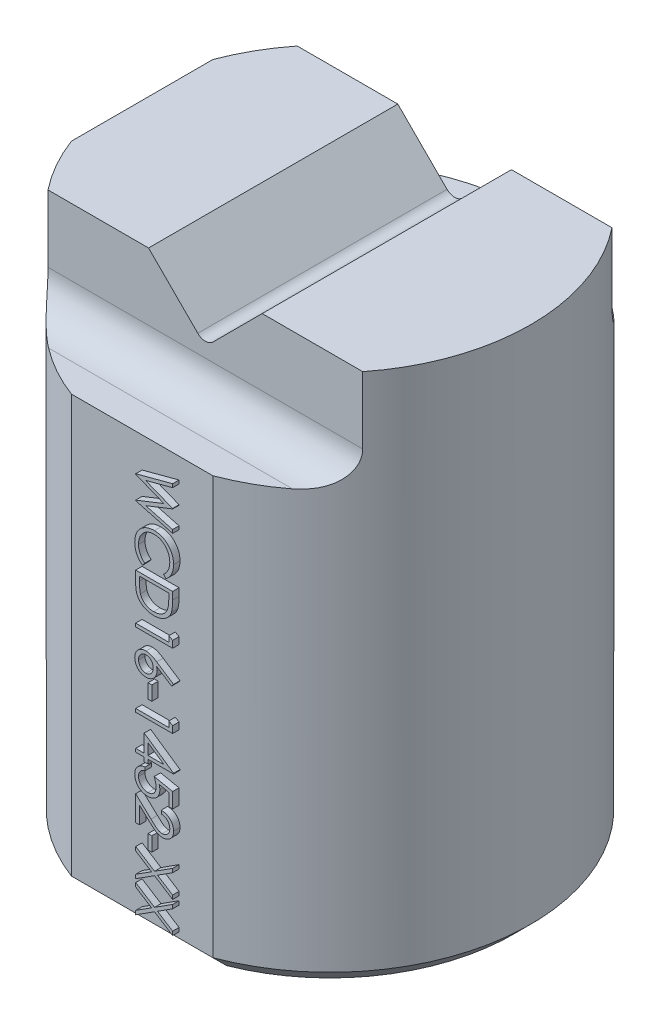
from build123d import *

# Parameters (mm, degrees)
CROQUIS3_R                 = 19.0246
SALIENTE_EXTRUIR1_DEPTH    = 50.8
CORTAR_EXTRUIR2_DEPTH      = 58.42
CORTAR_EXTRUIR2_DEPTH_BACK = 58.42
CORTAR_EXTRUIR4_DEPTH      = 58.42
CORTAR_EXTRUIR4_DEPTH_BACK = 58.42
CROQUIS9_R                 = 3.81
CORTAR_EXTRUIR1_START      = -58.42
CORTAR_EXTRUIR1_DEPTH      = 58.42
CROQUIS12_W                = 0.358974359
CROQUIS12_H                = 1.346153846
SALIENTE_EXTRUIR2_DEPTH    = 18.415
CHAFL_N1_SIZE              = 1.5875


with BuildPart() as part:
    # Croquis3 → Saliente-Extruir1 (new body)
    with BuildSketch(Plane(origin=(0, 0, 0), x_dir=(1, 0, 0), z_dir=(0, 1, 0))):
        with Locations(Location((0, 0, 0), (0, 0, 270))):
            Circle(CROQUIS3_R)
    extrude(amount=SALIENTE_EXTRUIR1_DEPTH)

    # Croquis7 → Cortar-Extruir2 (cut, two sides: drawn at the far end of the back side and taken through both)
    with BuildSketch(Plane(origin=(0, 0, 0), x_dir=(0, 0, -1), z_dir=(1, 0, 0)).offset(-CORTAR_EXTRUIR2_DEPTH_BACK)):
        with BuildLine():
            Line((19.0246, 50.8), (19.0246, 41.148))
            Line((19.0246, 41.148), (15.113, 41.148))
            ThreePointArc((15.113, 41.148), (12.778133409, 42.115133409), (11.811, 44.45))
            Line((11.811, 44.45), (11.811, 50.8))
            Line((11.811, 50.8), (19.0246, 50.8))
        make_face()
        with BuildLine():
            Line((-11.811, 50.8), (-19.0246, 50.8))
            Line((-19.0246, 50.8), (-19.0246, 41.148))
            Line((-19.0246, 41.148), (-15.113, 41.148))
            ThreePointArc((-15.113, 41.148), (-12.778133409, 42.115133409), (-11.811, 44.45))
            Line((-11.811, 44.45), (-11.811, 50.8))
        make_face()
    extrude(amount=CORTAR_EXTRUIR2_DEPTH + CORTAR_EXTRUIR2_DEPTH_BACK, mode=Mode.SUBTRACT)

    # Croquis9 → Cortar-Extruir4 (cut, two sides: drawn at the far end of the back side and taken through both)
    with BuildSketch(Plane.XY.offset(-CORTAR_EXTRUIR4_DEPTH_BACK)):
        with Locations((0, 50.803353673)):
            Circle(CROQUIS9_R)
        with BuildLine():
            Line((-5.3848, 50.8), (-0.71842049, 46.13362049))
            ThreePointArc((-0.71842049, 46.13362049), (0, 45.836040979), (0.71842049, 46.13362049))
            Line((0.71842049, 46.13362049), (5.3848, 50.8))
            Line((5.3848, 50.8), (-5.3848, 50.8))
        make_face()
    extrude(amount=CORTAR_EXTRUIR4_DEPTH + CORTAR_EXTRUIR4_DEPTH_BACK, mode=Mode.SUBTRACT)

    # Croquis4 → Cortar-Extruir1 (cut)
    with BuildSketch(Plane(origin=(0, 50.8, 0), x_dir=(1, 0, 0), z_dir=(0, 1, 0)).offset(CORTAR_EXTRUIR1_START)):
        with BuildLine():
            Line((0, -17.8054), (-6.700980227, -17.8054))
            ThreePointArc((-6.700980227, -17.8054), (0, -19.0246), (6.700980227, -17.8054))
            Line((6.700980227, -17.8054), (0, -17.8054))
        make_face()
        with BuildLine():
            Line((-17.8054, 0), (-17.8054, -6.700980227))
            ThreePointArc((-17.8054, -6.700980227), (-19.0246, 0), (-17.8054, 6.700980227))
            Line((-17.8054, 6.700980227), (-17.8054, 0))
        make_face()
    extrude(amount=CORTAR_EXTRUIR1_DEPTH, mode=Mode.SUBTRACT)

    # Croquis12 → Saliente-Extruir2 (add)
    # profile 1 of 13: a face of its own
    with BuildSketch(Plane.XY):
        Polygon((3.5, 4.666948718), (3.5, 4.30446875), (2.069010417, 3.388803686), (3.5, 2.473839744), (3.5, 2.10925641), (1.78505609, 3.206512019), (0, 2.064384615), (0, 2.426864583), (1.501802885, 3.388102564), (0, 4.348639423), (0, 4.711820513), (1.785757212, 3.569693109), align=None)
    # profile 2 of 13: a face of its own
    with BuildSketch(Plane.XY):
        Polygon((3.5, 7.628487179), (3.5, 7.266007212), (2.069010417, 6.350342147), (3.5, 5.435378205), (3.5, 5.070794872), (1.78505609, 6.168050481), (0, 5.025923077), (0, 5.388403045), (1.501802885, 6.349641026), (0, 7.310177885), (0, 7.673358974), (1.785757212, 6.531231571), align=None)
    # profile 3 of 13: a face of its own
    with BuildSketch(Plane.XY):
        with Locations((1.346153847, 8.638102564)):
            Rectangle(CROQUIS12_W, CROQUIS12_H)
    # profile 4 of 13: a face of its own
    with BuildSketch(Plane.XY):
        with BuildLine():
            Line((2.423076923, 11.554769231), (2.423076923, 11.868871795))
            add(Edge.make_bspline(
                [(2.423076923, 11.868871795), (2.464748016, 11.86682499), (2.546588934, 11.862805121), (2.665909934, 11.843971901), (2.779975252, 11.817048868), (2.887806988, 11.778892651), (2.990693283, 11.731773056), (3.087267925, 11.674085036), (3.178489406, 11.607058407), (3.262630601, 11.53081613), (3.339546174, 11.448086233), (3.406669589, 11.359364397), (3.46273344, 11.265562514), (3.5098564, 11.167494181), (3.545184955, 11.06402521), (3.571409677, 10.956144647), (3.587185182, 10.843364885), (3.588881084, 10.766524949), (3.58974359, 10.727445513)],
                knots=[0, 0, 0, 0, 1.100776268, 2.161895295, 3.184016182, 4.190939212, 5.176500551, 6.166955529, 7.155448256, 8.160289653, 9.16017456, 10.133824356, 11.091467644, 12.04088621, 13.000931625, 13.972173743, 14.968683325, 16, 16, 16, 16], degree=3))
            add(Edge.make_bspline(
                [(3.58974359, 10.727445513), (3.588845133, 10.689067439), (3.587079698, 10.613655894), (3.571918669, 10.50359388), (3.548173078, 10.398816585), (3.514857661, 10.299528819), (3.470073234, 10.206522754), (3.416275695, 10.11909971), (3.354055864, 10.036218899), (3.28080205, 9.961612115), (3.202599666, 9.893104036), (3.119111762, 9.834001781), (3.032882477, 9.783388617), (2.943254275, 9.741200937), (2.849383247, 9.710144798), (2.752636044, 9.68656659), (2.652011233, 9.673239177), (2.583904677, 9.671193753), (2.549278846, 9.670153846)],
                knots=[0, 0, 0, 0, 1.111607364, 2.184268762, 3.212621178, 4.221274766, 5.211760367, 6.196651075, 7.1921475, 8.207485113, 9.220403448, 10.201281604, 11.166441695, 12.114753415, 13.065576456, 14.026450734, 14.996634279, 16, 16, 16, 16], degree=3))
            add(Edge.make_bspline(
                [(2.549278846, 9.670153846), (2.500531028, 9.671844829), (2.403890848, 9.67519712), (2.261657256, 9.703989144), (2.123960365, 9.748782887), (2.012708427, 9.80201516), (1.923621611, 9.856555617), (1.850138441, 9.905614056), (1.771037485, 9.963087935), (1.68655876, 10.029763645), (1.596048281, 10.104277374), (1.499558358, 10.18729928), (1.398086626, 10.279422838), (1.328781019, 10.344081328), (1.29286859, 10.377585737)],
                knots=[0, 0, 0, 0, 1.184136889, 2.347493852, 3.513608722, 4.697895552, 5.335178528, 6.052199267, 6.845488095, 7.711597353, 8.668264519, 9.695616787, 10.805926351, 12, 12, 12, 12], degree=3))
            Line((1.29286859, 10.377585737), (0.358974359, 11.253286859))
            Line((0.358974359, 11.253286859), (0.358974359, 9.625282051))
            Line((0.358974359, 9.625282051), (0, 9.625282051))
            Line((0, 9.625282051), (0, 12.003487179))
            Line((0, 12.003487179), (1.448517628, 10.646115385))
            add(Edge.make_bspline(
                [(1.448517628, 10.646115385), (1.483014053, 10.613065158), (1.549274626, 10.549582437), (1.646042341, 10.459830643), (1.735709677, 10.379089433), (1.818673971, 10.307305249), (1.894464892, 10.244419025), (1.963676397, 10.19063197), (2.025714532, 10.145706354), (2.098594339, 10.098094564), (2.187681869, 10.052693562), (2.296003864, 10.012790727), (2.407759457, 9.988634094), (2.483257707, 9.98572148), (2.521233974, 9.98425641)],
                knots=[0, 0, 0, 0, 1.329530082, 2.553755191, 3.672934919, 4.687409497, 5.60679272, 6.413407421, 7.126401618, 7.737995624, 8.834647426, 9.90044882, 10.943907757, 12, 12, 12, 12], degree=3))
            add(Edge.make_bspline(
                [(2.521233974, 9.98425641), (2.545118012, 9.984885622), (2.592188863, 9.986125678), (2.661156757, 9.997277074), (2.727942288, 10.013660688), (2.7917197, 10.038912898), (2.853743372, 10.069252499), (2.91212759, 10.108013576), (2.968862533, 10.152307309), (3.022002807, 10.203685867), (3.07068755, 10.260089976), (3.113810711, 10.319686161), (3.149850063, 10.38273576), (3.179393496, 10.448976018), (3.202568894, 10.51822145), (3.218627469, 10.590606205), (3.228709954, 10.665930219), (3.230074126, 10.717363715), (3.230769231, 10.743571314)],
                knots=[0, 0, 0, 0, 0.991504627, 1.954065223, 2.895985987, 3.842598665, 4.797835564, 5.759220273, 6.74786863, 7.784730864, 8.824135544, 9.839918996, 10.835834653, 11.835434876, 12.84861661, 13.863796685, 14.911511676, 16, 16, 16, 16], degree=3))
            add(Edge.make_bspline(
                [(3.230769231, 10.743571314), (3.230054415, 10.770942268), (3.228650634, 10.824694303), (3.218824902, 10.903611613), (3.201890229, 10.978903664), (3.178673151, 11.050722869), (3.149442666, 11.119138426), (3.112332364, 11.183531721), (3.068791169, 11.244490644), (3.019156583, 11.301903234), (2.963634417, 11.354656397), (2.902503649, 11.40198027), (2.835366634, 11.442342532), (2.763739792, 11.47812186), (2.685718657, 11.505498341), (2.603193858, 11.528899494), (2.514992916, 11.545898701), (2.454224465, 11.551763277), (2.423076923, 11.554769231)],
                knots=[0, 0, 0, 0, 1.031212865, 2.025131798, 2.990757446, 3.934781266, 4.865570067, 5.788494791, 6.729227313, 7.684356718, 8.643577152, 9.610526866, 10.590658432, 11.59095419, 12.621640561, 13.700587263, 14.82141059, 16, 16, 16, 16], degree=3))
        make_face()
    # profile 5 of 13: a face of its own
    with BuildSketch(Plane.XY):
        with BuildLine():
            Line((3.5, 12.497076923), (3.141025641, 12.497076923))
            Line((3.141025641, 12.497076923), (3.141025641, 13.686880609))
            Line((3.141025641, 13.686880609), (2.220452724, 13.876183494))
            add(Edge.make_bspline(
                [(2.220452724, 13.876183494), (2.230682996, 13.839127619), (2.25050253, 13.767337723), (2.2725083, 13.661377862), (2.285773744, 13.560785659), (2.287585055, 13.495510289), (2.288461538, 13.463923878)],
                knots=[0, 0, 0, 0, 1.100273476, 2.13160584, 3.095893838, 4, 4, 4, 4], degree=3))
            add(Edge.make_bspline(
                [(2.288461538, 13.463923878), (2.287615381, 13.424840273), (2.285951625, 13.347992141), (2.269982922, 13.235551278), (2.244831581, 13.128225344), (2.20975253, 13.026197713), (2.16460626, 12.929248626), (2.108941852, 12.837919492), (2.043144334, 12.751692715), (1.967848539, 12.671708181), (1.884877575, 12.599258758), (1.795958621, 12.535307426), (1.701010796, 12.482120557), (1.600453954, 12.438362922), (1.494456815, 12.403645464), (1.382234792, 12.380474877), (1.264783752, 12.36506331), (1.184479588, 12.363340209), (1.143529647, 12.362461538)],
                knots=[0, 0, 0, 0, 1.052772836, 2.070014431, 3.053871312, 4.019926262, 4.972333346, 5.930471369, 6.896690565, 7.89035727, 8.885779078, 9.861050232, 10.836829716, 11.812751485, 12.812646763, 13.836748493, 14.896881366, 16, 16, 16, 16], degree=3))
            add(Edge.make_bspline(
                [(1.143529647, 12.362461538), (1.11500739, 12.363126524), (1.058348328, 12.364447509), (0.974204676, 12.37116741), (0.891839802, 12.38409824), (0.81125494, 12.401483994), (0.732557826, 12.423959989), (0.655777085, 12.451464292), (0.580676295, 12.483885086), (0.507250538, 12.520488929), (0.437763412, 12.562832793), (0.371142281, 12.607437111), (0.309838941, 12.656846418), (0.251615412, 12.708668561), (0.198758223, 12.764975694), (0.149005388, 12.824020133), (0.104518066, 12.887187505), (0.063599772, 12.953346878), (0.026963122, 13.022456533), (-0.003598389, 13.095217228), (-0.030385817, 13.170031676), (-0.052169495, 13.247566689), (-0.069070481, 13.327672058), (-0.080579823, 13.410623634), (-0.088953871, 13.496005178), (-0.089478555, 13.553880071), (-0.08974359, 13.583114583)],
                knots=[0, 0, 0, 0, 1.05623316, 2.098192244, 3.122504159, 4.140841222, 5.148757784, 6.150489607, 7.158294732, 8.176043417, 9.185147859, 10.169157858, 11.142149047, 12.097904048, 13.0527185, 13.998867679, 14.954465986, 15.910220987, 16.877849176, 17.847023716, 18.829548819, 19.818454515, 20.826519638, 21.858115382, 22.918063636, 24, 24, 24, 24], degree=3))
            add(Edge.make_bspline(
                [(-0.08974359, 13.583114583), (-0.089052691, 13.617988721), (-0.08769343, 13.686599468), (-0.073475808, 13.787120644), (-0.053108741, 13.883833027), (-0.02248395, 13.975971225), (0.015945705, 14.064312609), (0.064206634, 14.147681188), (0.119660638, 14.227715607), (0.184221067, 14.302240627), (0.255448024, 14.371268491), (0.331914473, 14.434008824), (0.413924458, 14.489031719), (0.500779798, 14.536561723), (0.592629943, 14.577045569), (0.689749741, 14.608864467), (0.791650622, 14.634541751), (0.861804012, 14.645405319), (0.897435897, 14.650923077)],
                knots=[0, 0, 0, 0, 1.046825758, 2.059506013, 3.044032586, 4.011925612, 4.970610144, 5.93275819, 6.900651216, 7.891265644, 8.889116719, 9.876966323, 10.858259055, 11.851035124, 12.847502422, 13.86866322, 14.9174643, 16, 16, 16, 16], degree=3))
            Line((0.897435897, 14.650923077), (0.897435897, 14.336820513))
            add(Edge.make_bspline(
                [(0.897435897, 14.336820513), (0.864056261, 14.329096819), (0.799898745, 14.314251452), (0.709809781, 14.281580974), (0.629226092, 14.241881547), (0.5580716, 14.193600698), (0.495697109, 14.137172103), (0.439632625, 14.073243352), (0.389723386, 14.000903697), (0.34785381, 13.920549253), (0.312197898, 13.835725533), (0.288442785, 13.746961156), (0.271742785, 13.656656069), (0.270070904, 13.595577798), (0.269230769, 13.564885417)],
                knots=[0, 0, 0, 0, 1.136389429, 2.184203582, 3.172920998, 4.111012962, 5.028380909, 5.957351669, 6.927793475, 7.937618031, 8.960409703, 9.974842029, 10.982339866, 12, 12, 12, 12], degree=3))
            add(Edge.make_bspline(
                [(0.269230769, 13.564885417), (0.270051547, 13.534926972), (0.271667666, 13.47593855), (0.284106678, 13.389127163), (0.303264249, 13.305314289), (0.331934104, 13.225326932), (0.366778822, 13.147765393), (0.411493898, 13.074591622), (0.462953917, 13.003688745), (0.521910547, 12.937260612), (0.586880241, 12.876421162), (0.656357635, 12.822665041), (0.730474481, 12.777888128), (0.807947634, 12.740154019), (0.889626191, 12.71150072), (0.975127366, 12.691059739), (1.064662347, 12.67905668), (1.125731656, 12.6774055), (1.156850962, 12.676564103)],
                knots=[0, 0, 0, 0, 1.027316725, 2.022795036, 3.002884548, 3.971462791, 4.93288096, 5.914575861, 6.907176829, 7.935150275, 8.956128384, 9.956726525, 10.942570165, 11.921478529, 12.907843606, 13.90538589, 14.932640048, 16, 16, 16, 16], degree=3))
            add(Edge.make_bspline(
                [(1.156850962, 12.676564103), (1.18494363, 12.677116522), (1.239962545, 12.678198425), (1.320101712, 12.690221023), (1.396479006, 12.707062818), (1.468411408, 12.732921244), (1.536952265, 12.764871524), (1.600634552, 12.805406609), (1.661094376, 12.851742387), (1.715875584, 12.906014398), (1.766777344, 12.96519572), (1.810106091, 13.03066015), (1.846574147, 13.100914496), (1.878041003, 13.175145636), (1.900642067, 13.255110105), (1.917609863, 13.339226858), (1.927425251, 13.428403533), (1.928787135, 13.489374225), (1.929487179, 13.520714744)],
                knots=[0, 0, 0, 0, 1.045726679, 2.048034203, 3.01323695, 3.95502507, 4.889743367, 5.8246644, 6.761650845, 7.722168973, 8.692072792, 9.66525385, 10.638902184, 11.638179751, 12.663148338, 13.728659964, 14.832472288, 16, 16, 16, 16], degree=3))
            add(Edge.make_bspline(
                [(1.929487179, 13.520714744), (1.928926304, 13.548079266), (1.927778104, 13.604098693), (1.918742011, 13.690228466), (1.904840851, 13.780344066), (1.884804843, 13.874795351), (1.859718381, 13.973323116), (1.828388536, 14.076091213), (1.792300505, 14.183102126), (1.764309399, 14.255128133), (1.75, 14.291948718)],
                knots=[0, 0, 0, 0, 0.824638674, 1.688163388, 2.607705698, 3.571998603, 4.597075385, 5.671199175, 6.809488238, 8, 8, 8, 8], degree=3))
            Line((1.75, 14.291948718), (3.5, 13.932974359))
            Line((3.5, 13.932974359), (3.5, 12.497076923))
        make_face()
    # profile 6 of 13: a face of its own
    with BuildSketch(Plane.XY):
        Polygon((3.58974359, 15.477545673), (3.58974359, 15.41374359), (1.166666667, 15.41374359), (1.166666667, 15.009897436), (0.807692308, 15.009897436), (0.807692308, 15.41374359), (0, 15.41374359), (0, 15.727846154), (0.807692308, 15.727846154), (0.807692308, 17.388102564), align=None)
        Polygon((1.166666667, 15.727846154), (2.685296474, 15.727846154), (1.166666667, 16.770414263), align=None, mode=Mode.SUBTRACT)
    # profile 7 of 13: a face of its own
    with BuildSketch(Plane.XY):
        Polygon((3.5, 19.336520032), (3.5, 18.689384615), (0, 18.689384615), (0, 19.003487179), (3.141025641, 19.003487179), (3.141025641, 19.541948718), align=None)
    # profile 8 of 13: a face of its own
    with BuildSketch(Plane.XY):
        with Locations((1.346153847, 21.022717949)):
            Rectangle(CROQUIS12_W, CROQUIS12_H)
    # profile 9 of 13: a face of its own
    with BuildSketch(Plane.XY):
        with BuildLine():
            Line((3.58974359, 22.772717949), (3.399739583, 22.530129808))
            Line((3.399739583, 22.530129808), (1.985576923, 23.454909455))
            add(Edge.make_bspline(
                [(1.985576923, 23.454909455), (1.995390784, 23.393339178), (2.014533829, 23.273239391), (2.017691774, 23.151673493), (2.019230769, 23.092429487)],
                knots=[0, 0, 0, 0, 1.025318673, 2, 2, 2, 2], degree=3))
            add(Edge.make_bspline(
                [(2.019230769, 23.092429487), (2.018288505, 23.056855201), (2.016439821, 22.987059892), (2.001830242, 22.884505458), (1.979090511, 22.785938065), (1.945809534, 22.691577603), (1.903309502, 22.601304315), (1.852370002, 22.514602002), (1.790364494, 22.433099969), (1.721099491, 22.355748796), (1.644382519, 22.285521697), (1.562981179, 22.223345642), (1.476980299, 22.17111885), (1.386423433, 22.128744928), (1.291450173, 22.09584005), (1.192182034, 22.071852405), (1.088550562, 22.057672812), (1.018072387, 22.055747321), (0.982271635, 22.054769231)],
                knots=[0, 0, 0, 0, 1.044136307, 2.048553127, 3.035567123, 4.010001674, 4.980053131, 5.96154148, 6.956538004, 7.981742224, 9.006487041, 10.005615874, 10.984750588, 11.954802044, 12.935714515, 13.930994945, 14.949008866, 16, 16, 16, 16], degree=3))
            add(Edge.make_bspline(
                [(0.982271635, 22.054769231), (0.933321047, 22.056595759), (0.83705467, 22.060187816), (0.696257255, 22.086336465), (0.563199166, 22.131463191), (0.437357507, 22.191837339), (0.322393647, 22.270168048), (0.218497146, 22.362994245), (0.127936082, 22.471193397), (0.050247518, 22.592203324), (-0.011475948, 22.723173645), (-0.057109366, 22.860500311), (-0.084376494, 23.003009528), (-0.087946329, 23.099792894), (-0.08974359, 23.148519231)],
                knots=[0, 0, 0, 0, 1.031881447, 2.029301251, 3.006342947, 3.987068354, 4.962916383, 5.929513747, 6.915671209, 7.928552063, 8.953527267, 9.960179832, 10.973036711, 12, 12, 12, 12], degree=3))
            add(Edge.make_bspline(
                [(-0.08974359, 23.148519231), (-0.088215388, 23.195615941), (-0.085188287, 23.288906276), (-0.058222293, 23.426138938), (-0.014515404, 23.558002458), (0.045699679, 23.683569946), (0.12175457, 23.7998976), (0.213327878, 23.903937278), (0.318395727, 23.995327004), (0.437280428, 24.070981528), (0.56420709, 24.13264017), (0.697761511, 24.176128902), (0.835255853, 24.204253179), (0.928849864, 24.207154812), (0.975961538, 24.208615385)],
                knots=[0, 0, 0, 0, 1.011913813, 2.004424092, 2.994488568, 3.992479987, 4.990471406, 5.973328987, 6.963763268, 7.974390938, 8.994854117, 9.989689954, 10.988086187, 12, 12, 12, 12], degree=3))
            add(Edge.make_bspline(
                [(0.975961538, 24.208615385), (1.011992998, 24.207346936), (1.085529615, 24.20475816), (1.197225054, 24.189308639), (1.311065619, 24.160972332), (1.407571272, 24.130306253), (1.487495437, 24.099876247), (1.550609439, 24.071660844), (1.617259852, 24.040112586), (1.686185585, 24.003133635), (1.759355993, 23.963932962), (1.834061355, 23.918142127), (1.913030141, 23.870358688), (1.965606332, 23.835353759), (1.992588141, 23.817389423)],
                knots=[0, 0, 0, 0, 1.17367173, 2.395347028, 3.66355231, 4.98980831, 5.690886799, 6.447442954, 7.240630024, 8.091733897, 8.994365608, 9.943299771, 10.944512865, 12, 12, 12, 12], degree=3))
            Line((1.992588141, 23.817389423), (3.58974359, 22.772717949))
        make_face()
        with BuildLine():
            add(Edge.make_bspline(
                [(1.66025641, 23.158334936), (1.659468059, 23.184996342), (1.657921319, 23.237305803), (1.649185356, 23.313954558), (1.632633, 23.38630165), (1.611222464, 23.455173907), (1.582069354, 23.519851671), (1.547081535, 23.581079486), (1.505467755, 23.638224697), (1.457762962, 23.690377722), (1.405981035, 23.738091502), (1.350942584, 23.780095357), (1.292870682, 23.815504814), (1.232264974, 23.84443574), (1.168808743, 23.866912627), (1.102852139, 23.883184462), (1.033937119, 23.892237247), (0.987204715, 23.893743612), (0.963341346, 23.894512821)],
                knots=[0, 0, 0, 0, 1.129054775, 2.21519617, 3.259426851, 4.267013074, 5.263608451, 6.256463875, 7.247987236, 8.249677815, 9.244060445, 10.225610515, 11.175892485, 12.118571871, 13.063688666, 14.021206195, 14.989551517, 16, 16, 16, 16], degree=3))
            add(Edge.make_bspline(
                [(0.963341346, 23.894512821), (0.939692266, 23.893884845), (0.893319942, 23.892653479), (0.824967916, 23.88152419), (0.759251192, 23.864402723), (0.696121704, 23.839341431), (0.635923815, 23.807907244), (0.578229919, 23.769224011), (0.523000197, 23.723946732), (0.471627345, 23.671312794), (0.424506917, 23.614552194), (0.382550799, 23.554524101), (0.347318879, 23.491419379), (0.31946527, 23.424877948), (0.296652499, 23.35583144), (0.280587851, 23.283753121), (0.271508182, 23.208579661), (0.269999871, 23.157657806), (0.269230769, 23.131692308)],
                knots=[0, 0, 0, 0, 0.989642335, 1.94054129, 2.892446913, 3.828371744, 4.778262963, 5.730973156, 6.732161388, 7.763274768, 8.805796303, 9.818398792, 10.825975928, 11.825728216, 12.834635236, 13.867465554, 14.912602056, 16, 16, 16, 16], degree=3))
            add(Edge.make_bspline(
                [(0.269230769, 23.131692308), (0.26999981, 23.105726767), (0.271508004, 23.054804829), (0.28058853, 22.979631973), (0.296650009, 22.907551419), (0.319474296, 22.838513035), (0.347285394, 22.771941613), (0.382771567, 22.708781653), (0.424251821, 22.648180451), (0.471708445, 22.591457088), (0.522709916, 22.538603154), (0.578729986, 22.494386368), (0.635465272, 22.454481044), (0.69636159, 22.424254156), (0.759213189, 22.39891376), (0.824978097, 22.381878678), (0.893317277, 22.370726358), (0.939691366, 22.369498156), (0.963341346, 22.368871795)],
                knots=[0, 0, 0, 0, 1.087205562, 2.132157158, 3.164804748, 4.173533273, 5.173108684, 6.180507559, 7.20098426, 8.243321352, 9.274252308, 10.269075238, 11.227079059, 12.172305571, 13.108064818, 14.05980203, 15.010532752, 16, 16, 16, 16], degree=3))
            add(Edge.make_bspline(
                [(0.963341346, 22.368871795), (0.987238671, 22.369415674), (1.034141346, 22.370483132), (1.102789445, 22.382790474), (1.169347332, 22.399413587), (1.232315684, 22.426278062), (1.293435829, 22.458275844), (1.350960907, 22.499038917), (1.406520615, 22.545774777), (1.458069581, 22.599899439), (1.505220459, 22.658782225), (1.546839016, 22.721399777), (1.58196424, 22.786907234), (1.611271333, 22.855241312), (1.632420594, 22.927184165), (1.649074723, 23.001574486), (1.657906821, 23.079131391), (1.659465487, 23.131673307), (1.66025641, 23.158334936)],
                knots=[0, 0, 0, 0, 0.978850575, 1.921165339, 2.853482305, 3.786193361, 4.721019802, 5.678231452, 6.671107257, 7.694736563, 8.738100728, 9.761595396, 10.773671158, 11.783065439, 12.804898115, 13.84455739, 14.906252091, 16, 16, 16, 16], degree=3))
        make_face(mode=Mode.SUBTRACT)
    # profile 10 of 13: a face of its own
    with BuildSketch(Plane.XY):
        Polygon((3.5, 26.336520032), (3.5, 25.689384615), (0, 25.689384615), (0, 26.003487179), (3.141025641, 26.003487179), (3.141025641, 26.541948718), align=None)
    # profile 11 of 13: a face of its own
    with BuildSketch(Plane.XY):
        with BuildLine():
            Line((0, 30.356051282), (3.5, 30.356051282))
            Line((3.5, 30.356051282), (3.5, 29.649320513))
            add(Edge.make_bspline(
                [(3.5, 29.649320513), (3.499558636, 29.587851397), (3.498705923, 29.469093385), (3.493268378, 29.297482649), (3.483746477, 29.138925357), (3.469609165, 28.993511552), (3.452640429, 28.861007616), (3.431060433, 28.741625767), (3.405680896, 28.635172539), (3.384034427, 28.569703226), (3.373798077, 28.53874359)],
                knots=[0, 0, 0, 0, 1.314317071, 2.539253741, 3.67075822, 4.709970291, 5.662644612, 6.526156501, 7.303037452, 8, 8, 8, 8], degree=3))
            add(Edge.make_bspline(
                [(3.373798077, 28.53874359), (3.358367354, 28.498248876), (3.327855826, 28.418177735), (3.270299776, 28.304170239), (3.205085737, 28.196846265), (3.132133327, 28.095622001), (3.049356095, 28.002840279), (2.960347486, 27.914760501), (2.861470361, 27.835336639), (2.756081895, 27.761381368), (2.643112969, 27.696669297), (2.524856338, 27.639600767), (2.401533274, 27.590874206), (2.272246166, 27.552854069), (2.138236163, 27.521442961), (1.998488812, 27.500366855), (1.853818803, 27.486366851), (1.755643076, 27.484966792), (1.705829327, 27.48425641)],
                knots=[0, 0, 0, 0, 0.98467389, 1.947018643, 2.898343565, 3.837828625, 4.779009928, 5.722093987, 6.681368302, 7.658573986, 8.646467994, 9.637429229, 10.641859304, 11.657149908, 12.698561448, 13.768651538, 14.867827761, 16, 16, 16, 16], degree=3))
            add(Edge.make_bspline(
                [(1.705829327, 27.48425641), (1.662568235, 27.484885802), (1.577317734, 27.486126083), (1.451674744, 27.497249332), (1.329768825, 27.513447821), (1.212135374, 27.538411621), (1.097981959, 27.569086111), (0.987850679, 27.606947891), (0.881660811, 27.651817765), (0.780277346, 27.703875831), (0.683868003, 27.760799015), (0.594091818, 27.823211956), (0.509241366, 27.887533188), (0.433143845, 27.958722291), (0.361446986, 28.031873544), (0.298024701, 28.110866017), (0.240114366, 28.193126183), (0.188138683, 28.2802385), (0.143044021, 28.374290919), (0.104412226, 28.47656713), (0.072602821, 28.587614895), (0.04602105, 28.707264004), (0.024946939, 28.835748905), (0.010819612, 28.973187454), (0.001266947, 29.119370863), (0.000430516, 29.219750112), (0, 29.271415865)],
                knots=[0, 0, 0, 0, 1.105818345, 2.179130549, 3.222742436, 4.24813173, 5.251184997, 6.243232575, 7.223185975, 8.195898781, 9.155064964, 10.083206407, 10.990357329, 11.874224667, 12.744762365, 13.607037788, 14.46074101, 15.315384698, 16.197310979, 17.123950979, 18.107232398, 19.148086642, 20.256146639, 21.433991621, 22.679261309, 24, 24, 24, 24], degree=3))
            Line((0, 29.271415865), (0, 30.356051282))
        make_face()
        with BuildLine():
            Line((0.358974359, 30.041948718), (0.358974359, 29.640205929))
            add(Edge.make_bspline(
                [(0.358974359, 29.640205929), (0.359222455, 29.582477559), (0.359699636, 29.47144476), (0.363886839, 29.311786763), (0.370728776, 29.165907367), (0.380303854, 29.033785857), (0.392972469, 28.915496833), (0.407097372, 28.810793083), (0.424694823, 28.720017825), (0.440645782, 28.665088388), (0.448016827, 28.639705128)],
                knots=[0, 0, 0, 0, 1.375205317, 2.645023457, 3.804390687, 4.853969522, 5.800190428, 6.637939096, 7.370582563, 8, 8, 8, 8], degree=3))
            add(Edge.make_bspline(
                [(0.448016827, 28.639705128), (0.459267547, 28.607756091), (0.481500263, 28.544621117), (0.522070049, 28.453749801), (0.570067383, 28.368956755), (0.623734571, 28.288827338), (0.683902764, 28.213880417), (0.750754071, 28.144448473), (0.823549172, 28.080038028), (0.90256076, 28.021353669), (0.987278009, 27.968916104), (1.076622395, 27.923210955), (1.170378287, 27.884430811), (1.268883606, 27.852896951), (1.372045499, 27.828460022), (1.47959257, 27.811073435), (1.59155837, 27.80026474), (1.667710145, 27.799002456), (1.706530449, 27.798358974)],
                knots=[0, 0, 0, 0, 0.998463025, 1.973077781, 2.929496817, 3.867873318, 4.813809365, 5.759268434, 6.706333209, 7.676553387, 8.657505312, 9.640584699, 10.632319813, 11.645628493, 12.686877747, 13.755137172, 14.855624085, 16, 16, 16, 16], degree=3))
            add(Edge.make_bspline(
                [(1.706530449, 27.798358974), (1.747463684, 27.798872809), (1.827877387, 27.799882241), (1.945871557, 27.812548796), (2.059339618, 27.831098453), (2.168363263, 27.857780687), (2.27280065, 27.892251833), (2.373241804, 27.933499353), (2.468394145, 27.983580318), (2.559063575, 28.040277264), (2.643876965, 28.10392997), (2.721840679, 28.174256075), (2.793099946, 28.250514032), (2.857768222, 28.332352393), (2.91469547, 28.420915395), (2.965337062, 28.514704379), (3.00836517, 28.615040488), (3.031242353, 28.684854498), (3.04286859, 28.720334135)],
                knots=[0, 0, 0, 0, 1.122272916, 2.204715076, 3.251197285, 4.274229216, 5.279697671, 6.265416158, 7.248880903, 8.225321784, 9.195852973, 10.153576302, 11.101466393, 12.055578741, 13.010401466, 13.985536859, 14.976245305, 16, 16, 16, 16], degree=3))
            add(Edge.make_bspline(
                [(3.04286859, 28.720334135), (3.050985018, 28.749685281), (3.06824277, 28.812093871), (3.087068143, 28.913933335), (3.103672642, 29.028548485), (3.117730681, 29.156448186), (3.127818002, 29.297486645), (3.135389317, 29.451772333), (3.140495949, 29.619371937), (3.140844657, 29.735554471), (3.141025641, 29.795854968)],
                knots=[0, 0, 0, 0, 0.674548936, 1.434276114, 2.292660221, 3.240891867, 4.284742987, 5.42552168, 6.663806718, 8, 8, 8, 8], degree=3))
            Line((3.141025641, 29.795854968), (3.141025641, 30.041948718))
            Line((3.141025641, 30.041948718), (0.358974359, 30.041948718))
        make_face(mode=Mode.SUBTRACT)
    # profile 12 of 13: a face of its own
    with BuildSketch(Plane.XY):
        with BuildLine():
            Line((2.857772436, 31.074), (2.647435897, 31.348839744))
            add(Edge.make_bspline(
                [(2.647435897, 31.348839744), (2.670801867, 31.368445632), (2.717218783, 31.407393079), (2.782398327, 31.470052281), (2.843463589, 31.535353924), (2.900705469, 31.603273045), (2.952122234, 31.675032165), (3.000393337, 31.748892964), (3.043661075, 31.826091009), (3.096124061, 31.932842743), (3.150870216, 32.072490592), (3.196773448, 32.248285431), (3.225994623, 32.431796529), (3.229159465, 32.556994129), (3.230769231, 32.620674679)],
                knots=[0, 0, 0, 0, 0.757959112, 1.505699292, 2.245454638, 2.979532153, 3.711538275, 4.438200793, 5.171680507, 5.909471876, 7.393775596, 8.890124382, 10.418191784, 12, 12, 12, 12], degree=3))
            add(Edge.make_bspline(
                [(3.230769231, 32.620674679), (3.230363445, 32.655757552), (3.229555641, 32.725597696), (3.218973416, 32.829252463), (3.20392868, 32.931167996), (3.1821483, 33.030965307), (3.153792222, 33.128446244), (3.120538112, 33.224353044), (3.079156746, 33.317556181), (3.033456552, 33.40917733), (2.981823731, 33.496952488), (2.925523467, 33.580020465), (2.865108338, 33.658001763), (2.800734294, 33.73111247), (2.731601295, 33.798550768), (2.658522608, 33.861397458), (2.580618642, 33.918519893), (2.499350418, 33.971321758), (2.41459849, 34.018305975), (2.326896016, 34.05887912), (2.236578315, 34.09365368), (2.143460367, 34.121425031), (2.047908611, 34.14333003), (1.949720267, 34.158462999), (1.849085923, 34.168950027), (1.780876701, 34.169750401), (1.746494391, 34.170153846)],
                knots=[0, 0, 0, 0, 1.055000685, 2.100209969, 3.131349012, 4.153242145, 5.170189196, 6.184191144, 7.204341339, 8.235672124, 9.263040994, 10.265373269, 11.252624173, 12.22887325, 13.193405896, 14.155809299, 15.126090485, 16.097288279, 17.069732292, 18.038585918, 19.002221264, 19.978698174, 20.959418239, 21.948869816, 22.966084182, 24, 24, 24, 24], degree=3))
            add(Edge.make_bspline(
                [(1.746494391, 34.170153846), (1.694763071, 34.168892027), (1.593195486, 34.166414613), (1.444424876, 34.144366279), (1.301904202, 34.110861187), (1.16652436, 34.060645611), (1.036616002, 33.99872656), (0.914377148, 33.920485948), (0.797960584, 33.829869411), (0.690117636, 33.725594992), (0.591603911, 33.611189176), (0.504853329, 33.488441264), (0.432538447, 33.357656976), (0.3723625, 33.220280346), (0.326105772, 33.075254232), (0.293541649, 32.92283943), (0.272299468, 32.763367435), (0.27026578, 32.654398035), (0.269230769, 32.598939904)],
                knots=[0, 0, 0, 0, 1.029171465, 2.020641659, 2.987623507, 3.938342917, 4.889210282, 5.84687017, 6.821220943, 7.821438502, 8.827599549, 9.822697543, 10.807740252, 11.797342354, 12.80366471, 13.83203677, 14.896651826, 16, 16, 16, 16], degree=3))
            add(Edge.make_bspline(
                [(0.269230769, 32.598939904), (0.270919549, 32.537837215), (0.274243472, 32.417572506), (0.302402721, 32.24120448), (0.348060638, 32.072368714), (0.411958561, 31.911056127), (0.495023849, 31.757721481), (0.595721726, 31.612124821), (0.715010059, 31.47414325), (0.806093187, 31.391171968), (0.852564103, 31.348839744)],
                knots=[0, 0, 0, 0, 1.028121516, 2.023589091, 2.998037872, 3.967518031, 4.937445131, 5.927275754, 6.942489185, 8, 8, 8, 8], degree=3))
            Line((0.852564103, 31.348839744), (0.644330929, 31.074))
            add(Edge.make_bspline(
                [(0.644330929, 31.074), (0.615792429, 31.096118081), (0.558852125, 31.140248297), (0.478581139, 31.21170675), (0.403074401, 31.28698242), (0.332956835, 31.366644183), (0.266764666, 31.449739281), (0.206716932, 31.537731395), (0.150984484, 31.629100729), (0.100628049, 31.724379249), (0.05547798, 31.823254144), (0.017361042, 31.925622515), (-0.015946051, 32.030617092), (-0.04316627, 32.138290751), (-0.064445988, 32.2490032), (-0.078663293, 32.362374582), (-0.088405847, 32.478644212), (-0.089293675, 32.557085667), (-0.08974359, 32.596836538)],
                knots=[0, 0, 0, 0, 0.986756325, 1.968786143, 2.935506311, 3.899499537, 4.868307269, 5.8376204, 6.809456583, 7.792545619, 8.781780509, 9.778496008, 10.776623214, 11.79151764, 12.812666265, 13.856269958, 14.913646641, 16, 16, 16, 16], degree=3))
            add(Edge.make_bspline(
                [(-0.08974359, 32.596836538), (-0.089481597, 32.634480206), (-0.088963539, 32.708915896), (-0.080571372, 32.818814647), (-0.069121635, 32.925804228), (-0.051881504, 33.029578854), (-0.031537164, 33.130704829), (-0.004265907, 33.228265413), (0.026283259, 33.323220624), (0.062188246, 33.415188964), (0.102704429, 33.504248664), (0.148495987, 33.590112476), (0.199177852, 33.672740908), (0.253632863, 33.752946329), (0.313610164, 33.829543913), (0.378276799, 33.903197438), (0.44741481, 33.974319914), (0.497269663, 34.018322599), (0.522335737, 34.040446314)],
                knots=[0, 0, 0, 0, 1.114604814, 2.203992996, 3.262667896, 4.300477797, 5.318619304, 6.316056647, 7.298880507, 8.271930387, 9.238335007, 10.195173496, 11.151986948, 12.108099108, 13.064862484, 14.031167946, 15.010108607, 16, 16, 16, 16], degree=3))
            add(Edge.make_bspline(
                [(0.522335737, 34.040446314), (0.565876926, 34.075881958), (0.652433637, 34.146325434), (0.792719618, 34.236451118), (0.939187827, 34.313598673), (1.092607755, 34.375974594), (1.252635143, 34.424737327), (1.419350657, 34.458518522), (1.592598599, 34.480470127), (1.710435388, 34.482980415), (1.770332532, 34.48425641)],
                knots=[0, 0, 0, 0, 0.994628077, 1.977248131, 2.950237994, 3.925870899, 4.908910175, 5.911660606, 6.938484602, 8, 8, 8, 8], degree=3))
            add(Edge.make_bspline(
                [(1.770332532, 34.48425641), (1.833285352, 34.482694261), (1.957141094, 34.479620829), (2.138952641, 34.453724314), (2.312890308, 34.411559784), (2.479623367, 34.353498946), (2.638197835, 34.276901176), (2.789283438, 34.184173381), (2.93275681, 34.074409835), (3.066783632, 33.948989062), (3.18931972, 33.811414479), (3.297126777, 33.66409756), (3.386844068, 33.507315114), (3.461840291, 33.342797396), (3.519484737, 33.169311678), (3.559837929, 32.987228319), (3.584955044, 32.796889401), (3.588130252, 32.667026976), (3.58974359, 32.601043269)],
                knots=[0, 0, 0, 0, 1.032901378, 2.032168977, 3.007206631, 3.966850309, 4.924221947, 5.891988639, 6.871730993, 7.884084801, 8.900290346, 9.89161143, 10.874607481, 11.860025555, 12.854717796, 13.869097222, 14.917278314, 16, 16, 16, 16], degree=3))
            add(Edge.make_bspline(
                [(3.58974359, 32.601043269), (3.589261812, 32.560828718), (3.588308181, 32.481228065), (3.578996816, 32.363476555), (3.563502411, 32.248830029), (3.542274027, 32.137011231), (3.516255146, 32.027614682), (3.482194419, 31.92176271), (3.442641565, 31.81887891), (3.39824916, 31.718886229), (3.347498469, 31.622872557), (3.292377899, 31.530855366), (3.231615083, 31.443944676), (3.167218841, 31.360505691), (3.096780331, 31.282416887), (3.022593437, 31.207448067), (2.942456775, 31.138188935), (2.886052222, 31.095435479), (2.857772436, 31.074)],
                knots=[0, 0, 0, 0, 1.096705196, 2.170817488, 3.219277236, 4.250701065, 5.274195539, 6.284202015, 7.28098643, 8.279664616, 9.266225751, 10.241373748, 11.203306326, 12.157093976, 13.114198862, 14.069774147, 15.032234603, 16, 16, 16, 16], degree=3))
        make_face()
    # profile 13 of 13: a face of its own
    with BuildSketch(Plane.XY):
        Polygon((3.5, 39.195794872), (3.5, 38.871876603), (0.931089744, 38.186179487), (3.5, 37.168150641), (3.5, 37.122577724), (0.950721154, 36.122076923), (3.5, 35.433575321), (3.5, 35.112461538), (0, 36.056171474), (0, 36.101043269), (2.675480769, 37.154128205), (0, 38.21843109), (0, 38.264004006), align=None)
    extrude(amount=SALIENTE_EXTRUIR2_DEPTH)

    # Chaflán1
    # the kernel refuses this chamfer: 1.5875 mm, written as the material it takes off along each edge
    with BuildSketch(Plane(origin=(0, 0, 0), x_dir=(0.14429341464635104, 0, 0.9895349465732356), z_dir=(-0.9895349465732356, 0, 0.14429341464635104))) as chafl_n1_piece_1:
        Polygon((19.0246 - CHAFL_N1_SIZE, 0), (19.0246, CHAFL_N1_SIZE), (19.0246, 0), align=None)
    revolve(axis=Axis((0, 0, 0), (0, 1, 0)), revolution_arc=253.40727091, mode=Mode.SUBTRACT)
    with BuildSketch(Plane(origin=(0, 0, 0), x_dir=(-0.9894579755550965, 0, 0.14482028383624285), z_dir=(-0.14482028383624285, 0, -0.9894579755550965))) as chafl_n1_piece_2:
        Polygon((19.0246, CHAFL_N1_SIZE), (19.0246 - CHAFL_N1_SIZE, 0), (19.0246, 0), align=None)
    revolve(axis=Axis((0, 0, 0), (0, 1, 0)), revolution_arc=73.346255269, mode=Mode.SUBTRACT)
    with BuildSketch(Plane(origin=(-17.8054, 0, 10.78352697), x_dir=(-0.02749587661058565, 0.9996219169112968, 0), z_dir=(0, 0, -1))) as chafl_n1_piece_3:
        Polygon((CHAFL_N1_SIZE * 0.999621916911, CHAFL_N1_SIZE * 0.0274958766106), (-CHAFL_N1_SIZE * 0.0274958766106, CHAFL_N1_SIZE * 0.999621916911), (0, 0), align=None)
    extrude(amount=21.56705394, mode=Mode.SUBTRACT)
    with BuildSketch(Plane(origin=(-10.78352697, 0, 17.8054), x_dir=(0, 0.9996219169112968, 0.02749587661058565), z_dir=(1, 0, 0))) as chafl_n1_piece_4:
        Polygon((CHAFL_N1_SIZE * 0.999621916911, -CHAFL_N1_SIZE * 0.0274958766106), (-CHAFL_N1_SIZE * 0.0274958766106, -CHAFL_N1_SIZE * 0.999621916911), (0, 0), align=None)
    extrude(amount=21.56705394, mode=Mode.SUBTRACT)


solid = part.part
